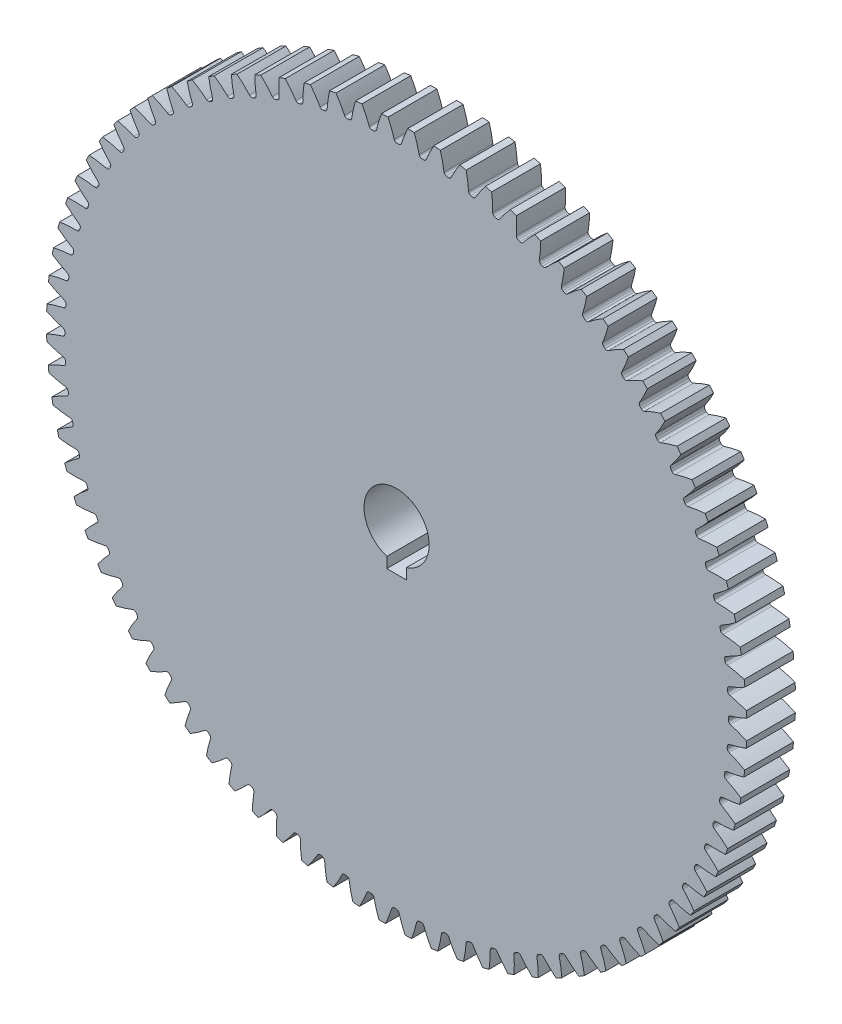
from build123d import *

# Parameters (mm, degrees)
SKETCH_1_R                       = 107.5
EXTRUDE_1_DEPTH                  = 7.5
CUT_EXTRUDE_1_DEPTH              = 153.212844399
FILLET_1_R                       = 0.875
PATTERN_CIRCULAR_1_COUNT         = 84
FILLET_1_OF_PATTERN_CIRCULAR_1_R = 0.875
CUT_EXTRUDE_2_DEPTH              = 153.168046791
CUT_EXTRUDE_2_DEPTH_BACK         = 153.168046791


with BuildPart() as part:
    # 草图1 → 凸台-拉伸1 (new, symmetric)
    with BuildSketch(Plane.XY):
        Circle(SKETCH_1_R)
    extrude(amount=EXTRUDE_1_DEPTH, both=True)

    # 草图4 → 切除-拉伸1 (cut, symmetric)
    with BuildSketch(Plane.XY):
        with BuildLine():
            ThreePointArc((136.106922993, -30.749723556), (139.536229988, -0.52962839), (136.336427309, 29.715628447))
            add(Edge.make_bspline(
                [(101.873489143, 0.55482857), (101.936375918, 0.57135646), (102.356509468, 0.683318277), (103.13070599, 0.908393205), (104.248859219, 1.278233014), (105.983134961, 1.937651042), (108.022327389, 2.837284155), (110.289844788, 3.995674283), (112.806121745, 5.471759235), (115.241119485, 7.077983804), (117.595633469, 8.799838064), (119.910857214, 10.661955074), (122.14376405, 12.621832179), (124.026293945, 14.414583384), (125.589490575, 16.002037872), (126.858858672, 17.356768141), (127.854412997, 18.458769424), (129.07423551, 19.858387197), (130.261059691, 21.285783059), (131.415663433, 22.740100496), (132.761895126, 24.514319885), (133.743516942, 25.86786718), (134.592087243, 27.084207067), (135.320922514, 28.164403036), (135.722397473, 28.7688339), (136.058858127, 29.285063844), (136.245245691, 29.573621491), (136.336427309, 29.715628447)],
                knots=[0.060062054, 0.060062054, 0.060062054, 0.060062054, 0.060062054, 0.064854849, 0.092110525, 0.119476175, 0.146842495, 0.201574955, 0.256307345, 0.307035032, 0.361767351, 0.41649966, 0.471231936, 0.525964281, 0.580696615, 0.608062798, 0.635428982, 0.662795184, 0.690161387, 0.744893688, 0.772259885, 0.799626083, 0.854358408, 0.868041535, 0.881724662, 0.895407789, 0.909090916, 0.909090916, 0.909090916, 0.909090916, 0.909090916], degree=4))
            ThreePointArc((101.873489143, 0.55482857), (101.874622285, 0.277415314), (101.875, 0))
            ThreePointArc((101.875, 0), (101.872835488, -0.66408926), (101.866342046, -1.3281503))
            add(Edge.make_bspline(
                [(101.866342046, -1.3281503), (101.929101832, -1.345155175), (102.348373764, -1.460303185), (103.12083992, -1.691248861), (104.23615404, -2.069566369), (105.965374613, -2.742130893), (107.997679655, -3.657218372), (110.25633887, -4.832788785), (112.761338849, -6.327933396), (115.184073989, -7.95259693), (117.525449874, -9.692275907), (119.826471851, -11.571915396), (122.044437126, -13.548687322), (123.913304125, -15.35567831), (125.464405408, -16.954954283), (126.723453198, -18.31928213), (127.710613551, -19.428809589), (128.919776404, -20.837647553), (130.095730987, -22.274012321), (131.239261673, -23.737053306), (132.571986372, -25.521441846), (133.543305025, -26.882402405), (134.382617534, -28.105149429), (135.103231932, -29.190847467), (135.500104561, -29.798305075), (135.83263372, -30.317069683), (136.016824083, -30.607031829), (136.106922993, -30.749723556)],
                knots=[0.060062033, 0.060062033, 0.060062033, 0.060062033, 0.060062033, 0.064854849, 0.092110525, 0.119476175, 0.146842495, 0.201574955, 0.256307345, 0.307035032, 0.361767351, 0.41649966, 0.471231936, 0.525964281, 0.580696615, 0.608062798, 0.635428982, 0.662795184, 0.690161387, 0.744893688, 0.772259885, 0.799626083, 0.854358408, 0.868041535, 0.881724662, 0.895407789, 0.909090576, 0.909090576, 0.909090576, 0.909090576, 0.909090576], degree=4))
        make_face()
    cut_extrude_1 = extrude(amount=CUT_EXTRUDE_1_DEPTH, both=True, mode=Mode.SUBTRACT)

    # 圆角1
    fillet_1_edges = [part.edges().sort_by_distance(p)[0] for p in [
        (101.866342046, -1.3281503, -3.75),
        (101.873489143, 0.55482857, 3.75),
    ]]
    fillet(fillet_1_edges, radius=FILLET_1_R)

    # 阵列(圆周)1: 切除-拉伸1 ×84 about axis
    pattern_circular_1_axis = Axis((0, 0, 7.5), (0, 0, -1))
    for i in range(1, PATTERN_CIRCULAR_1_COUNT):
        add(cut_extrude_1.rotate(pattern_circular_1_axis, i * 360 / PATTERN_CIRCULAR_1_COUNT), mode=Mode.SUBTRACT)

    # 圆角1 of 阵列(圆周)1
    fillet_1_of_pattern_circular_1_edges = [part.edges().sort_by_distance(p)[0] for p in [
        (101.482250297, -8.936917796, -3.75),
        (101.630092597, -7.059738221, 3.75),
        (100.530628639, -16.495706424, -3.75),
        (100.818339348, -14.634824092, 3.75),
        (99.016798927, -23.962244369, -3.75),
        (99.442769049, -22.12806609, 3.75),
        (96.949227111, -31.294775725, -3.75),
        (97.511074448, -29.497558967, 3.75),
        (94.33947589, -38.452294, -3.75),
        (95.034058365, -36.702089529, 3.75),
        (91.202140052, -45.394771449, -3.75),
        (92.025573277, -43.701367118, 3.75),
        (87.554764852, -52.083382922, -3.75),
        (88.502443855, -50.456248935, 3.75),
        (83.417747892, -58.480722992, -3.75),
        (84.484372867, -56.928958942, 3.75),
        (78.814225048, -64.551015136, -3.75),
        (79.993830996, -63.083299117, 3.75),
        (73.769941088, -70.260311819, -3.75),
        (75.055931174, -68.884851895, 3.75),
        (68.313105693, -75.576684339, -3.75),
        (69.698288139, -74.301172639, 3.75),
        (62.4742357, -80.470401382, -3.75),
        (63.950864004, -79.301971086, 3.75),
        (56.28598444, -84.9140953, -3.75),
        (57.845800697, -83.859280743, 3.75),
        (49.782959123, -88.882915152, -3.75),
        (51.417240208, -87.947615285, 3.75),
        (43.001527305, -92.354665688, -3.75),
        (44.701133655, -91.544111088, 3.75),
        (35.979613503, -95.309931472, -3.75),
        (37.73504023, -94.628655088, 3.75),
        (28.756487108, -97.732185457, -3.75),
        (30.557917154, -97.183997264, 3.75),
        (21.372542772, -99.607881417, -3.75),
        (23.209901809, -99.195847106, 3.75),
        (13.869074507, -100.9265297, -3.75),
        (15.732087279, -100.652953533, 3.75),
        (6.288044752, -101.680755889, -3.75),
        (8.166292535, -101.547167815, 3.75),
        (-1.3281503, -101.866342046, -3.75),
        (0.55482857, -101.873489143, 3.75),
        (-8.936917796, -101.482250297, -3.75),
        (-7.059738221, -101.630092597, 3.75),
        (-16.495706424, -100.530628639, -3.75),
        (-14.634824092, -100.818339348, 3.75),
        (-23.962244369, -99.016798927, -3.75),
        (-22.12806609, -99.442769049, 3.75),
        (-31.294775725, -96.949227111, -3.75),
        (-29.497558967, -97.511074448, 3.75),
        (-38.452294, -94.33947589, -3.75),
        (-36.702089529, -95.034058365, 3.75),
        (-45.394771449, -91.202140052, -3.75),
        (-43.701367118, -92.025573277, 3.75),
        (-52.083382922, -87.554764852, -3.75),
        (-50.456248935, -88.502443855, 3.75),
        (-58.480722992, -83.417747892, -3.75),
        (-56.928958942, -84.484372867, 3.75),
        (-64.551015136, -78.814225048, -3.75),
        (-63.083299117, -79.993830996, 3.75),
        (-70.260311819, -73.769941088, -3.75),
        (-68.884851895, -75.055931174, 3.75),
        (-75.576684339, -68.313105693, -3.75),
        (-74.301172639, -69.698288139, 3.75),
        (-80.470401382, -62.4742357, -3.75),
        (-79.301971086, -63.950864004, 3.75),
        (-84.9140953, -56.28598444, -3.75),
        (-83.859280743, -57.845800697, 3.75),
        (-88.882915152, -49.782959123, -3.75),
        (-87.947615285, -51.417240208, 3.75),
        (-92.354665688, -43.001527305, -3.75),
        (-91.544111088, -44.701133655, 3.75),
        (-95.309931472, -35.979613503, -3.75),
        (-94.628655088, -37.73504023, 3.75),
        (-97.732185457, -28.756487108, -3.75),
        (-97.183997264, -30.557917154, 3.75),
        (-99.607881417, -21.372542772, -3.75),
        (-99.195847106, -23.209901809, 3.75),
        (-100.9265297, -13.869074507, -3.75),
        (-100.652953533, -15.732087279, 3.75),
        (-101.680755889, -6.288044752, -3.75),
        (-101.547167815, -8.166292535, 3.75),
        (-101.866342046, 1.3281503, -3.75),
        (-101.873489143, -0.55482857, 3.75),
        (-101.482250297, 8.936917796, -3.75),
        (-101.630092597, 7.059738221, 3.75),
        (-100.530628639, 16.495706424, -3.75),
        (-100.818339348, 14.634824092, 3.75),
        (-99.016798927, 23.962244369, -3.75),
        (-99.442769049, 22.12806609, 3.75),
        (-96.949227111, 31.294775725, -3.75),
        (-97.511074448, 29.497558967, 3.75),
        (-94.33947589, 38.452294, -3.75),
        (-95.034058365, 36.702089529, 3.75),
        (-91.202140052, 45.394771449, -3.75),
        (-92.025573277, 43.701367118, 3.75),
        (-87.554764852, 52.083382922, -3.75),
        (-88.502443855, 50.456248935, 3.75),
        (-83.417747892, 58.480722992, -3.75),
        (-84.484372867, 56.928958942, 3.75),
        (-78.814225048, 64.551015136, -3.75),
        (-79.993830996, 63.083299117, 3.75),
        (-73.769941088, 70.260311819, -3.75),
        (-75.055931174, 68.884851895, 3.75),
        (-68.313105693, 75.576684339, -3.75),
        (-69.698288139, 74.301172639, 3.75),
        (-62.4742357, 80.470401382, -3.75),
        (-63.950864004, 79.301971086, 3.75),
        (-56.28598444, 84.9140953, -3.75),
        (-57.845800697, 83.859280743, 3.75),
        (-49.782959123, 88.882915152, -3.75),
        (-51.417240208, 87.947615285, 3.75),
        (-43.001527305, 92.354665688, -3.75),
        (-44.701133655, 91.544111088, 3.75),
        (-35.979613503, 95.309931472, -3.75),
        (-37.73504023, 94.628655088, 3.75),
        (-28.756487108, 97.732185457, -3.75),
        (-30.557917154, 97.183997264, 3.75),
        (-21.372542772, 99.607881417, -3.75),
        (-23.209901809, 99.195847106, 3.75),
        (-13.869074507, 100.9265297, -3.75),
        (-15.732087279, 100.652953533, 3.75),
        (-6.288044752, 101.680755889, -3.75),
        (-8.166292535, 101.547167815, 3.75),
        (1.3281503, 101.866342046, -3.75),
        (-0.55482857, 101.873489143, 3.75),
        (8.936917796, 101.482250297, -3.75),
        (7.059738221, 101.630092597, 3.75),
        (16.495706424, 100.530628639, -3.75),
        (14.634824092, 100.818339348, 3.75),
        (23.962244369, 99.016798927, -3.75),
        (22.12806609, 99.442769049, 3.75),
        (31.294775725, 96.949227111, -3.75),
        (29.497558967, 97.511074448, 3.75),
        (38.452294, 94.33947589, -3.75),
        (36.702089529, 95.034058365, 3.75),
        (45.394771449, 91.202140052, -3.75),
        (43.701367118, 92.025573277, 3.75),
        (52.083382922, 87.554764852, -3.75),
        (50.456248935, 88.502443855, 3.75),
        (58.480722992, 83.417747892, -3.75),
        (56.928958942, 84.484372867, 3.75),
        (64.551015136, 78.814225048, -3.75),
        (63.083299117, 79.993830996, 3.75),
        (70.260311819, 73.769941088, -3.75),
        (68.884851895, 75.055931174, 3.75),
        (75.576684339, 68.313105693, -3.75),
        (74.301172639, 69.698288139, 3.75),
        (80.470401382, 62.4742357, -3.75),
        (79.301971086, 63.950864004, 3.75),
        (84.9140953, 56.28598444, -3.75),
        (83.859280743, 57.845800697, 3.75),
        (88.882915152, 49.782959123, -3.75),
        (87.947615285, 51.417240208, 3.75),
        (92.354665688, 43.001527305, -3.75),
        (91.544111088, 44.701133655, 3.75),
        (95.309931472, 35.979613503, -3.75),
        (94.628655088, 37.73504023, 3.75),
        (97.732185457, 28.756487108, -3.75),
        (97.183997264, 30.557917154, 3.75),
        (99.607881417, 21.372542772, -3.75),
        (99.195847106, 23.209901809, 3.75),
        (100.9265297, 13.869074507, -3.75),
        (100.652953533, 15.732087279, 3.75),
        (101.680755889, 6.288044752, -3.75),
        (101.547167815, 8.166292535, 3.75),
    ]]
    fillet(fillet_1_of_pattern_circular_1_edges, radius=FILLET_1_OF_PATTERN_CIRCULAR_1_R)

    # 草图5 → 切除-拉伸2 (cut, two sides: drawn at the far end of the back side and taken through both)
    with BuildSketch(Plane.XY.offset(-CUT_EXTRUDE_2_DEPTH_BACK)):
        with BuildLine():
            Line((-3, -9.539392014), (-3, -12.8))
            Line((-3, -12.8), (3, -12.8))
            Line((3, -12.8), (3, -9.539392014))
            ThreePointArc((3, -9.539392014), (0, 10), (-3, -9.539392014))
        make_face()
    extrude(amount=CUT_EXTRUDE_2_DEPTH + CUT_EXTRUDE_2_DEPTH_BACK, mode=Mode.SUBTRACT)


solid = part.part
